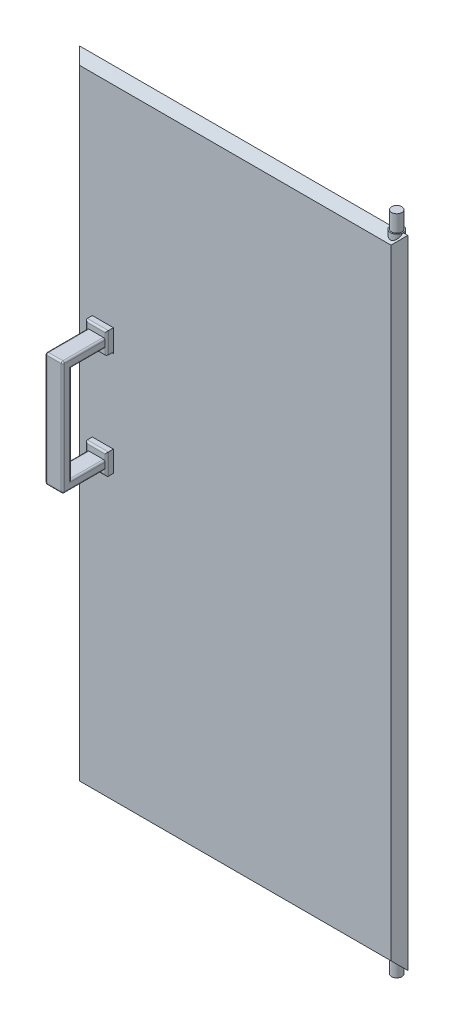
from build123d import *

# Parameters (mm, degrees)
SKETCH1_W            = 390
SKETCH1_H            = 756.8
BOSS_EXTRUDE1_DEPTH  = 20
SKETCH2_R            = 6.05
BOSS_EXTRUDE2_DEPTH  = 10
BOSS_EXTRUDE3_START  = 10
SKETCH3_R            = 6.05
BOSS_EXTRUDE3_DEPTH  = 10
CHAMFER1_SIZE        = 10
BOSS_EXTRUDE4_DEPTH  = 50
SKETCH5_W            = 30
SKETCH5_H            = 160
CUT_EXTRUDE1_DEPTH   = 131
CHAMFER2_SIZE        = 10
CUT_EXTRUDE2_DEPTH   = 78
SKETCH7_W            = 25
SKETCH7_H            = 25
BOSS_EXTRUDE5_DEPTH  = 8
FILLET1_R            = 2
FILLET2_R            = 2
SKETCH8_W            = 21
SKETCH8_H            = 10.491742635
SKETCH8_H_2          = 10.163875677
BOSS_EXTRUDE6_DEPTH  = 40
SKETCH9_W            = 21
SKETCH9_H            = 135.736920339
BOSS_EXTRUDE7_DEPTH  = 10
FILLET3_R            = 2
FILLET4_R            = 2
SKETCH15_R           = 7.5
BOSS_EXTRUDE17_DEPTH = 20
SKETCH17_R           = 7.5
CUT_EXTRUDE7_DEPTH   = 10
SKETCH18_R           = 6.05
BOSS_EXTRUDE18_DEPTH = 20


with BuildPart() as part:
    # Sketch1 → Boss-Extrude1 (new body)
    with BuildSketch(Plane.XY):
        with Locations((147.890593688, -358.84384058)):
            Rectangle(SKETCH1_W, SKETCH1_H)
    extrude(amount=BOSS_EXTRUDE1_DEPTH)

    # Sketch2 → Boss-Extrude2 (add)
    with BuildSketch(Plane(origin=(0, 19.55615942, 0), x_dir=(1, 0, 0), z_dir=(0, 1, 0))):
        with Locations(Location((329.77827945, -10, 0), (0, 0, 90))):
            Circle(SKETCH2_R)
    extrude(amount=BOSS_EXTRUDE2_DEPTH)

    # Sketch3 → Boss-Extrude3 (add)
    with BuildSketch(Plane.XZ.offset(737.24384058).offset(BOSS_EXTRUDE3_START)):
        with Locations(Location((329.77827945, 10, 0), (0, 0, 270))):
            Circle(SKETCH3_R)
    extrude(amount=-BOSS_EXTRUDE3_DEPTH)

    # Chamfer1
    # the kernel refuses this chamfer: 10 mm, written as the material it takes off along each edge
    with BuildSketch(Plane(origin=(368.607423567, -737.24384058, 0), x_dir=(0, 0.9996219169112968, -0.027495876610586487), z_dir=(-1, 0, 0))) as chamfer1_piece_1_section:
        Polygon((CHAMFER1_SIZE * 0.999621916911, -CHAMFER1_SIZE * 0.0274958766106), (-CHAMFER1_SIZE * 0.0274958766106, -CHAMFER1_SIZE * 0.999621916911), (0, 0), align=None)
    chamfer1_piece_1 = extrude(amount=441.433659759, mode=Mode.PRIVATE)
    chamfer1_piece_1 = chamfer1_piece_1 - Plane(origin=(329.77827945, -733.933944157, 10), x_dir=(0, 0, -1), z_dir=(0, -1, 0)) * Cylinder(6.05, 923, mode=Mode.PRIVATE)
    add(chamfer1_piece_1, mode=Mode.SUBTRACT)
    with BuildSketch(Plane(origin=(-47.109406312, -762.960670459, 0), x_dir=(-0.027495876610586317, 0, 0.9996219169112968), z_dir=(0, 1, 0)), Plane(origin=(342.890593688, 45.2729893, 20), x_dir=(-0.9996219169112968, 0, 0.027495876610586282), z_dir=(0, -1, 0))) as chamfer1_piece_2:
        Polygon((CHAMFER1_SIZE * 0.999621916911, CHAMFER1_SIZE * 0.0274958766106), (-CHAMFER1_SIZE * 0.0274958766106, CHAMFER1_SIZE * 0.999621916911), (0, 0), align=None)
    extrude(amount=808.233659759, mode=Mode.SUBTRACT)
    with BuildSketch(Plane(origin=(-72.826236192, 19.55615942, 0), x_dir=(0, 0.027495876610586317, 0.9996219169112968), z_dir=(1, 0, 0))) as chamfer1_piece_3_section:
        Polygon((CHAMFER1_SIZE * 0.999621916911, CHAMFER1_SIZE * 0.0274958766106), (-CHAMFER1_SIZE * 0.0274958766106, CHAMFER1_SIZE * 0.999621916911), (0, 0), align=None)
    chamfer1_piece_3 = extrude(amount=441.433659759, mode=Mode.PRIVATE)
    chamfer1_piece_3 = chamfer1_piece_3 - Plane(origin=(329.77827945, 16.24626296, 10), x_dir=(0, 0, -1), z_dir=(0, -1, 0)) * Cylinder(6.05, 923, mode=Mode.PRIVATE)
    add(chamfer1_piece_3, mode=Mode.SUBTRACT)
    with BuildSketch(Plane(origin=(342.890593688, 45.2729893, 0), x_dir=(-0.9996219169112968, 0, -0.027495876610586334), z_dir=(0, -1, 0)), Plane(origin=(-47.109406312, -762.960670459, 20), x_dir=(-0.027495876610586317, 0, -0.9996219169112968), z_dir=(0, 1, 0))) as chamfer1_piece_4:
        Polygon((CHAMFER1_SIZE * 0.999621916911, -CHAMFER1_SIZE * 0.0274958766106), (-CHAMFER1_SIZE * 0.0274958766106, -CHAMFER1_SIZE * 0.999621916911), (0, 0), align=None)
    extrude(amount=808.233659759, mode=Mode.SUBTRACT)
    with BuildSketch(Plane(origin=(368.607423567, -737.24384058, 20), x_dir=(0, 0.9996219169112968, 0.02749587661058643), z_dir=(-1, 0, 0))) as chamfer1_piece_5_section:
        Polygon((CHAMFER1_SIZE * 0.999621916911, CHAMFER1_SIZE * 0.0274958766106), (-CHAMFER1_SIZE * 0.0274958766106, CHAMFER1_SIZE * 0.999621916911), (0, 0), align=None)
    chamfer1_piece_5 = extrude(amount=441.433659759, mode=Mode.PRIVATE)
    chamfer1_piece_5 = chamfer1_piece_5 - Plane(origin=(329.77827945, -733.933944133, 10), x_dir=(0, 0, -1), z_dir=(0, -1, 0)) * Cylinder(6.05, 923, mode=Mode.PRIVATE)
    add(chamfer1_piece_5, mode=Mode.SUBTRACT)
    with BuildSketch(Plane(origin=(-72.826236192, 19.55615942, 20), x_dir=(0, 0.027495876610586317, -0.9996219169112968), z_dir=(1, 0, 0))) as chamfer1_piece_6_section:
        Polygon((CHAMFER1_SIZE * 0.999621916911, -CHAMFER1_SIZE * 0.0274958766106), (-CHAMFER1_SIZE * 0.0274958766106, -CHAMFER1_SIZE * 0.999621916911), (0, 0), align=None)
    chamfer1_piece_6 = extrude(amount=441.433659759, mode=Mode.PRIVATE)
    chamfer1_piece_6 = chamfer1_piece_6 - Plane(origin=(329.77827945, 16.246262993, 10), x_dir=(0, 0, -1), z_dir=(0, -1, 0)) * Cylinder(6.05, 923, mode=Mode.PRIVATE)
    add(chamfer1_piece_6, mode=Mode.SUBTRACT)

    # Sketch4 → Boss-Extrude4 (add)
    with BuildSketch(Plane.XY.offset(20)):
        Polygon((12.890593688, -358.84384058), (12.890593688, -258.84384058), (-37.109406312, -258.84384058), (-37.109406312, -458.84384058), (12.890593688, -458.84384058), align=None)
    extrude(amount=BOSS_EXTRUDE4_DEPTH)

    # Sketch5 → Cut-Extrude1 (cut)
    with BuildSketch(Plane.ZY.offset(37.109406312)):
        with Locations((35, -358.84384058)):
            Rectangle(SKETCH5_W, SKETCH5_H)
    extrude(amount=-CUT_EXTRUDE1_DEPTH, mode=Mode.SUBTRACT)

    # Chamfer2
    chamfer2_edges = [part.edges().sort_by_distance(p)[0] for p in [
        (-37.109406312, -458.84384058, 45),
        (12.890593688, -458.84384058, 45),
        (12.890593688, -258.84384058, 45),
        (-37.109406312, -258.84384058, 45),
        (-12.109406312, -458.84384058, 70),
        (12.890593688, -358.84384058, 70),
        (-12.109406312, -258.84384058, 70),
        (-37.109406312, -358.84384058, 70),
    ]]
    chamfer(chamfer2_edges, length=CHAMFER2_SIZE)

    # Sketch6 → Cut-Extrude2 (cut)
    with BuildSketch(Plane.XY.offset(20)):
        Polygon((-37.109406312, -268.84384058), (-27.109406312, -258.84384058), (2.890593688, -258.84384058), (12.890593688, -268.84384058), (12.890593688, -448.84384058), (2.890593688, -458.84384058), (-27.109406312, -458.84384058), (-37.109406312, -448.84384058), align=None)
    extrude(amount=CUT_EXTRUDE2_DEPTH, mode=Mode.SUBTRACT)

    # Sketch7 → Boss-Extrude5 (add)
    with BuildSketch(Plane.XY.offset(20)):
        with Locations((-9.609406312, -252.94384058)):
            Rectangle(SKETCH7_W, SKETCH7_H)
        with Locations((-9.609406312, -377.94384058)):
            Rectangle(SKETCH7_W, SKETCH7_H)
    extrude(amount=BOSS_EXTRUDE5_DEPTH)

    # Fillet1
    fillet1_edges = [part.edges().sort_by_distance(p)[0] for p in [
        (-9.609406312, -265.44384058, 20),
        (-22.109406312, -252.94384058, 28),
        (2.890593688, -252.94384058, 28),
        (-9.609406312, -240.44384058, 28),
    ]]
    fillet(fillet1_edges, radius=FILLET1_R)

    # Fillet2
    fillet2_edges = [part.edges().sort_by_distance(p)[0] for p in [
        (-22.109406312, -377.94384058, 28),
        (-9.609406312, -390.44384058, 28),
        (2.890593688, -377.94384058, 28),
        (-9.609406312, -365.44384058, 28),
    ]]
    fillet(fillet2_edges, radius=FILLET2_R)

    # Sketch8 → Boss-Extrude6 (add)
    with BuildSketch(Plane.XY.offset(28)):
        with Locations((-9.609406312, -253.671430769)):
            Rectangle(SKETCH8_W, SKETCH8_H)
        with Locations((-9.609406312, -379.080541951)):
            Rectangle(SKETCH8_W, SKETCH8_H_2)
    extrude(amount=BOSS_EXTRUDE6_DEPTH)

    # Sketch9 → Boss-Extrude7 (add)
    with BuildSketch(Plane.XY.offset(68)):
        with Locations((-9.609406312, -316.294019621)):
            Rectangle(SKETCH9_W, SKETCH9_H)
    extrude(amount=BOSS_EXTRUDE7_DEPTH)

    # Fillet3
    fillet3_edges = [part.edges().sort_by_distance(p)[0] for p in [
        (-20.109406312, -316.457953099, 68),
        (0.890593688, -316.457953099, 68),
        (-20.109406312, -316.294019621, 78),
        (0.890593688, -316.294019621, 78),
    ]]
    fillet(fillet3_edges, radius=FILLET3_R)

    # Fillet4
    fillet4_edges = [part.edges().sort_by_distance(p)[0] for p in [
        (0.30480725, -248.425559451, 77.414213562),
        (-9.609406312, -248.425559451, 78),
        (-19.523619875, -248.425559451, 77.414213562),
        (0.30480725, -384.16247979, 77.414213562),
        (-19.523619875, -384.16247979, 77.414213562),
        (0.890593688, -258.917302086, 49),
        (0.890593688, -248.425559451, 52),
        (-20.109406312, -248.425559451, 52),
        (-20.109406312, -258.917302086, 49),
        (0.890593688, -373.998604113, 49),
        (-20.109406312, -373.998604113, 49),
        (-9.609406312, -384.16247979, 78),
        (0.890593688, -384.16247979, 52),
        (-20.109406312, -384.16247979, 52),
    ]]
    fillet(fillet4_edges, radius=FILLET4_R)

    # Sketch15 → Boss-Extrude17 (add)
    with BuildSketch(Plane(origin=(0, 29.55615942, 0), x_dir=(1, 0, 0), z_dir=(0, 1, 0))):
        with Locations(Location((329.77827945, -10, 0), (0, 0, 270))):
            Circle(SKETCH15_R)
    extrude(amount=-BOSS_EXTRUDE17_DEPTH)

    # Sketch17 → Cut-Extrude7 (cut)
    with BuildSketch(Plane(origin=(0, 29.55615942, 0), x_dir=(1, 0, 0), z_dir=(0, 1, 0))):
        with Locations((329.77827945, -10)):
            Circle(SKETCH17_R)
    extrude(amount=-CUT_EXTRUDE7_DEPTH, mode=Mode.SUBTRACT)

    # Sketch18 → Boss-Extrude18 (add)
    with BuildSketch(Plane(origin=(0, 19.55615942, 0), x_dir=(1, 0, 0), z_dir=(0, 1, 0))):
        with Locations(Location((329.77827945, -10, 0), (0, 0, 180))):
            Circle(SKETCH18_R)
    extrude(amount=BOSS_EXTRUDE18_DEPTH)


solid = part.part
